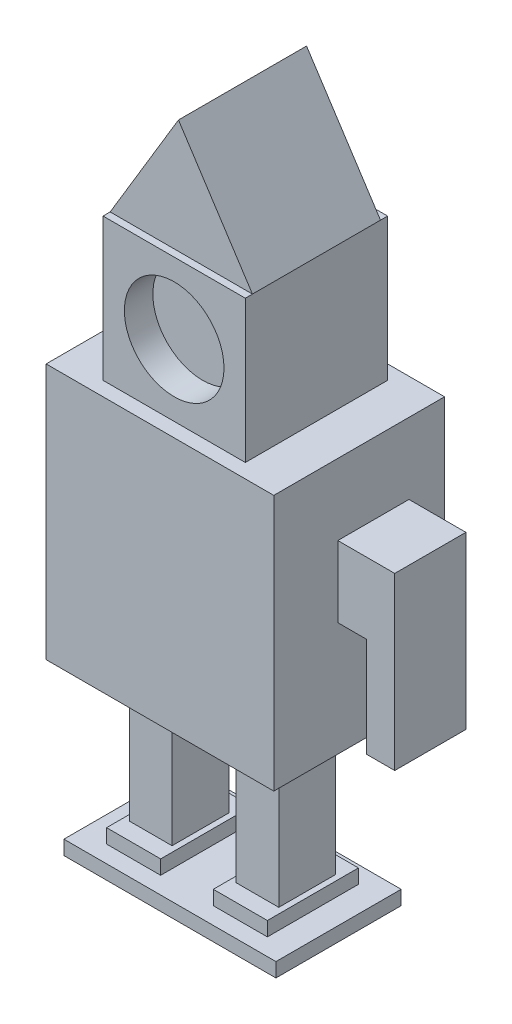
from build123d import *

# Parameters (mm, degrees)
SKETCH1_W             = 50
SKETCH1_H             = 50
BOSS_EXTRUDE1_DEPTH   = 25
BOSS_EXTRUDE2_DEPTH   = 22.5
SKETCH4_W             = 80
SKETCH4_H             = 90
BOSS_EXTRUDE4_DEPTH   = 30
SKETCH5_W             = 25
SKETCH5_H             = 25
BOSS_EXTRUDE5_DEPTH   = 10
SKETCH6_W             = 25
SKETCH6_H             = 60
BOSS_EXTRUDE6_DEPTH   = 10
SKETCH7_W             = 15
SKETCH7_H             = 10
BOSS_EXTRUDE7_DEPTH   = 50
SKETCH8_W             = 19
SKETCH8_H             = 30
BOSS_EXTRUDE10_DEPTH  = 5
MIRROR3_START         = -1.25
MIRROR3_DEPTH         = 15
MIRROR3_START_2       = 36.25
MIRROR3_2_OUTLINE_W   = 5
MIRROR3_2_OUTLINE_H   = 2
MIRROR3_2_OUTLINE_W_2 = 50
MIRROR3_2_OUTLINE_H_2 = 10
MIRROR3_2_DEPTH       = 15
MIRROR3_START_3       = -3.25
MIRROR3_3_OUTLINE_W   = 5
MIRROR3_3_OUTLINE_H   = 32
MIRROR3_3_DEPTH       = 19
MIRROR3_START_4       = 34.25
MIRROR3_4_OUTLINE_W   = 5
MIRROR3_4_OUTLINE_H   = 2
MIRROR3_4_DEPTH       = 19
SKETCH9_W             = 74.5
SKETCH9_H             = 44
BOSS_EXTRUDE11_DEPTH  = 5
SKETCH10_R            = 17.5
CUT_EXTRUDE1_DEPTH    = 10


# Read off the part's stored shape, not the designer's step: Mirror3
with BuildPart() as part:
    # Sketch1 → Boss-Extrude1 (new, symmetric)
    with BuildSketch(Plane.XY):
        with Locations((25, 25)):
            Rectangle(SKETCH1_W, SKETCH1_H)
    extrude(amount=BOSS_EXTRUDE1_DEPTH, both=True)

    # Sketch2 → Boss-Extrude2 (add, symmetric)
    with BuildSketch(Plane.XY):
        Polygon((0, 50), (24.011645754, 90), (50, 50), align=None)
    extrude(amount=BOSS_EXTRUDE2_DEPTH, both=True)

    # Sketch4 → Boss-Extrude4 (add, symmetric)
    with BuildSketch(Plane.XY):
        with Locations((25, -45)):
            Rectangle(SKETCH4_W, SKETCH4_H)
    extrude(amount=BOSS_EXTRUDE4_DEPTH, both=True)

    # Sketch5 → Boss-Extrude5 (add)
    with BuildSketch(Plane(origin=(65, 0, 0), x_dir=(0, 0, -1), z_dir=(1, 0, 0))):
        with Locations((5, -37.5)):
            Rectangle(SKETCH5_W, SKETCH5_H)
    boss_extrude5 = extrude(amount=BOSS_EXTRUDE5_DEPTH)

    # Sketch6 → Boss-Extrude6 (add)
    with BuildSketch(Plane(origin=(75, 0, 0), x_dir=(0, 0, -1), z_dir=(1, 0, 0))):
        with Locations((5, -55)):
            Rectangle(SKETCH6_W, SKETCH6_H)
    boss_extrude6 = extrude(amount=BOSS_EXTRUDE6_DEPTH)

    # Mirror1: Boss-Extrude5, Boss-Extrude6 across plane
    add(boss_extrude5.mirror(Plane(origin=(25, 0, 0), x_dir=(0, 0, 1), z_dir=(1, 0, 0))))
    add(boss_extrude6.mirror(Plane(origin=(25, 0, 0), x_dir=(0, 0, 1), z_dir=(1, 0, 0))))

    # Sketch7 → Boss-Extrude7 (add)
    with BuildSketch(Plane.XZ.offset(90)):
        with Locations((43.75, -0.5)):
            Rectangle(SKETCH7_W, SKETCH7_H)
    extrude(amount=BOSS_EXTRUDE7_DEPTH)

    # Sketch8 → Boss-Extrude10 (add)
    with BuildSketch(Plane.XZ.offset(140)):
        with Locations((43.75, 5.5)):
            Rectangle(SKETCH8_W, SKETCH8_H)
    extrude(amount=BOSS_EXTRUDE10_DEPTH)

    # Mirror3 outline → Mirror3 (add)
    with BuildSketch(Plane.YZ.offset(MIRROR3_START)):
        Polygon((-90, -5.5), (-90, 14.5), (-140, 14.5), (-140, 20.5), (-145, 20.5), (-145, -11.5), (-140, -11.5), (-140, -5.5), align=None)
    extrude(amount=MIRROR3_DEPTH)

    # Mirror3 2 outline → Mirror3 2 (add)
    with BuildSketch(Plane.YZ.offset(MIRROR3_START_2)):
        with Locations((-142.5, -10.5)):
            Rectangle(MIRROR3_2_OUTLINE_W, MIRROR3_2_OUTLINE_H)
        with Locations((-115, 9.5)):
            Rectangle(MIRROR3_2_OUTLINE_W_2, MIRROR3_2_OUTLINE_H_2)
    extrude(amount=MIRROR3_2_DEPTH)

    # Mirror3 3 outline → Mirror3 3 (add)
    with BuildSketch(Plane.YZ.offset(MIRROR3_START_3)):
        with Locations((-142.5, 4.5)):
            Rectangle(MIRROR3_3_OUTLINE_W, MIRROR3_3_OUTLINE_H)
    extrude(amount=MIRROR3_3_DEPTH)

    # Mirror3 4 outline → Mirror3 4 (add)
    with BuildSketch(Plane.YZ.offset(MIRROR3_START_4)):
        with Locations((-142.5, -10.5)):
            Rectangle(MIRROR3_4_OUTLINE_W, MIRROR3_4_OUTLINE_H)
    extrude(amount=MIRROR3_4_DEPTH)

    # Sketch9 → Boss-Extrude11 (add)
    with BuildSketch(Plane.XZ.offset(145)):
        with Locations((25, 4.5)):
            Rectangle(SKETCH9_W, SKETCH9_H)
    extrude(amount=BOSS_EXTRUDE11_DEPTH)

    # Sketch10 → Cut-Extrude1 (cut)
    with BuildSketch(Plane.XY.offset(25)):
        with Locations((25, 25)):
            Circle(SKETCH10_R)
    extrude(amount=-CUT_EXTRUDE1_DEPTH, mode=Mode.SUBTRACT)


solid = part.part
